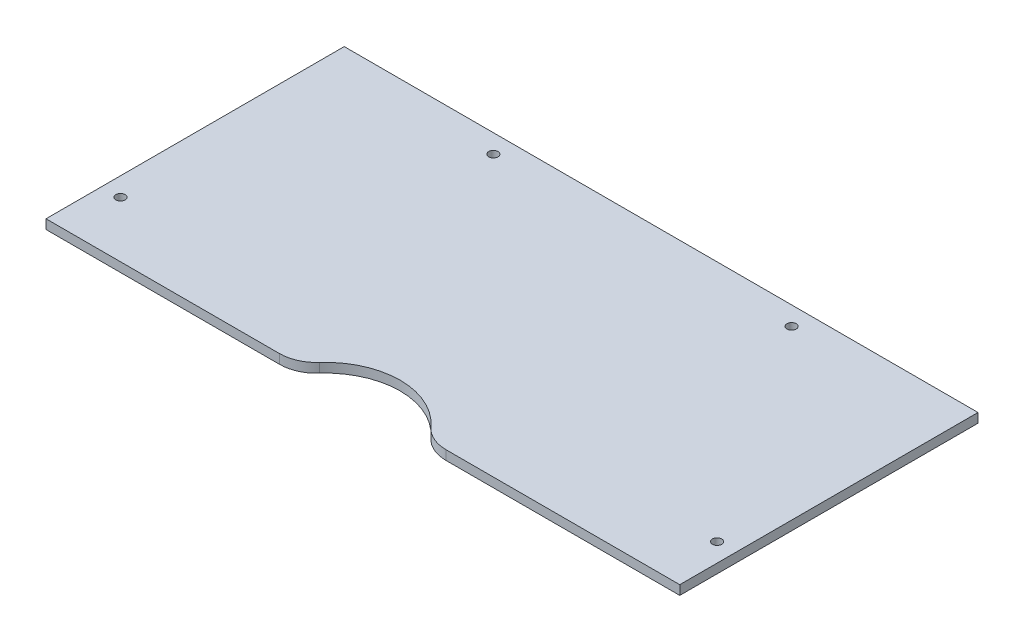
from build123d import *

# Parameters (mm, degrees)
BOSS_EXTRUDE1_DEPTH = 3.175
FILLET1_R           = 12.7
SKETCH2_R           = 1.5875
CUT_EXTRUDE1_DEPTH  = 315.453256661


with BuildPart() as part:
    # Sketch1 → Boss-Extrude1 (new body)
    with BuildSketch(Plane(origin=(0, 0, 0), x_dir=(1, 0, 0), z_dir=(0, 1, 0))):
        with BuildLine():
            Line((0, 228.6), (0, 127))
            Line((0, 127), (85.952954744, 127))
            ThreePointArc((85.952954744, 127), (107.95, 139.7), (129.947045256, 127))
            Line((129.947045256, 127), (215.9, 127))
            Line((215.9, 127), (215.9, 228.6))
            Line((215.9, 228.6), (0, 228.6))
        make_face()
    extrude(amount=BOSS_EXTRUDE1_DEPTH)

    # Fillet1
    fillet1_edges = [part.edges().sort_by_distance(p)[0] for p in [
        (129.947045256, 1.5875, -127),
        (85.952954744, 1.5875, -127),
    ]]
    fillet(fillet1_edges, radius=FILLET1_R)

    # Sketch2 → Cut-Extrude1 (cut, through all)
    with BuildSketch(Plane(origin=(0, 3.175, 0), x_dir=(1, 0, 0), z_dir=(0, 1, 0))):
        with Locations((6.35, 146.05)):
            Circle(SKETCH2_R)
        with Locations((57.15, 222.25)):
            Circle(SKETCH2_R)
        with Locations((158.75, 222.25)):
            Circle(SKETCH2_R)
        with Locations((209.55, 146.05)):
            Circle(SKETCH2_R)
    extrude(amount=-CUT_EXTRUDE1_DEPTH, mode=Mode.SUBTRACT)


solid = part.part
